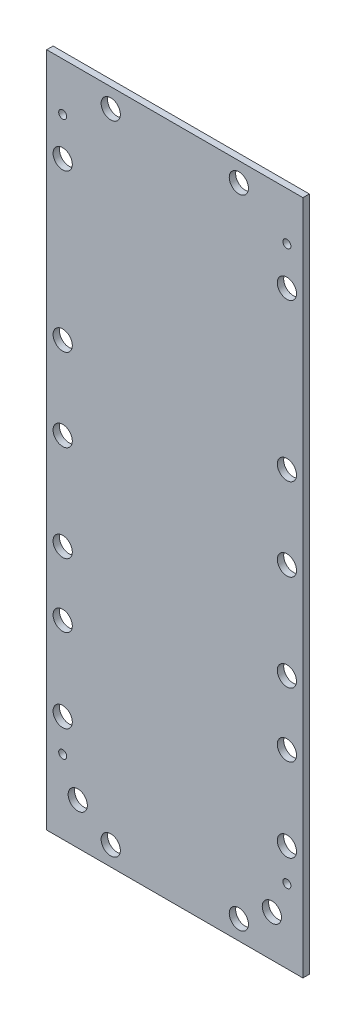
from build123d import *

# Parameters (mm, degrees)
SKETCH2_W                 = 80
SKETCH2_H                 = 211
BOSS_EXTRUDE1_DEPTH       = 2
M3X0_5_TAPPED_HOLE1_D     = 2.5
M3X0_5_TAPPED_HOLE1_DEPTH = 10
M3X0_5_TAPPED_HOLE1_TIP   = 0.751075774
CUT_EXTRUDE1_START        = -2
CUT_EXTRUDE1_OUTLINE_R    = 3
CUT_EXTRUDE1_DEPTH        = 2


# Read off the part's stored shape, not the designer's step: Cut-Extrude1
with BuildPart() as part:
    # Sketch2 → Boss-Extrude1 (new body)
    with BuildSketch(Plane.XY):
        with Locations((40, 105.5)):
            Rectangle(SKETCH2_W, SKETCH2_H)
    extrude(amount=BOSS_EXTRUDE1_DEPTH)

    # M3x0.5 Tapped Hole1
    with Locations(Plane(origin=(0, 0, 0), x_dir=(-1, 0, 0), z_dir=(0, 0, -1))):
        with Locations((-75, 196), (-5, 196), (-75, 23), (-5, 23)):
            Hole(M3X0_5_TAPPED_HOLE1_D / 2, depth=M3X0_5_TAPPED_HOLE1_DEPTH)
            with Locations((0, 0, -(M3X0_5_TAPPED_HOLE1_DEPTH + M3X0_5_TAPPED_HOLE1_TIP / 2))):  # 118° drill point
                Cone(0, M3X0_5_TAPPED_HOLE1_D / 2, M3X0_5_TAPPED_HOLE1_TIP, mode=Mode.SUBTRACT)

    # Cut-Extrude1 outline → Cut-Extrude1 (cut)
    with BuildSketch(Plane(origin=(0, 0, 0), x_dir=(-1, 0, 0), z_dir=(0, 0, -1)).offset(CUT_EXTRUDE1_START)):
        with Locations((-75, 184)):
            Circle(CUT_EXTRUDE1_OUTLINE_R)
        with Locations((-9.7, 13)):
            Circle(CUT_EXTRUDE1_OUTLINE_R)
        with Locations((-75, 33.2)):
            Circle(CUT_EXTRUDE1_OUTLINE_R)
        with Locations((-5, 184)):
            Circle(CUT_EXTRUDE1_OUTLINE_R)
        with Locations((-5, 135)):
            Circle(CUT_EXTRUDE1_OUTLINE_R)
        with Locations((-5, 109.2)):
            Circle(CUT_EXTRUDE1_OUTLINE_R)
        with Locations((-75, 59.2)):
            Circle(CUT_EXTRUDE1_OUTLINE_R)
        with Locations((-75, 79.2)):
            Circle(CUT_EXTRUDE1_OUTLINE_R)
        with Locations((-75, 109.2)):
            Circle(CUT_EXTRUDE1_OUTLINE_R)
        with Locations((-75, 135)):
            Circle(CUT_EXTRUDE1_OUTLINE_R)
        with Locations((-60, 205)):
            Circle(CUT_EXTRUDE1_OUTLINE_R)
        with Locations((-70.3, 13)):
            Circle(CUT_EXTRUDE1_OUTLINE_R)
        with Locations((-20, 6)):
            Circle(CUT_EXTRUDE1_OUTLINE_R)
        with Locations((-60, 6)):
            Circle(CUT_EXTRUDE1_OUTLINE_R)
        with Locations((-5, 79.2)):
            Circle(CUT_EXTRUDE1_OUTLINE_R)
        with Locations((-5, 59.2)):
            Circle(CUT_EXTRUDE1_OUTLINE_R)
        with Locations((-5, 33.2)):
            Circle(CUT_EXTRUDE1_OUTLINE_R)
        with Locations((-20, 205)):
            Circle(CUT_EXTRUDE1_OUTLINE_R)
    extrude(amount=CUT_EXTRUDE1_DEPTH, mode=Mode.SUBTRACT)


solid = part.part
